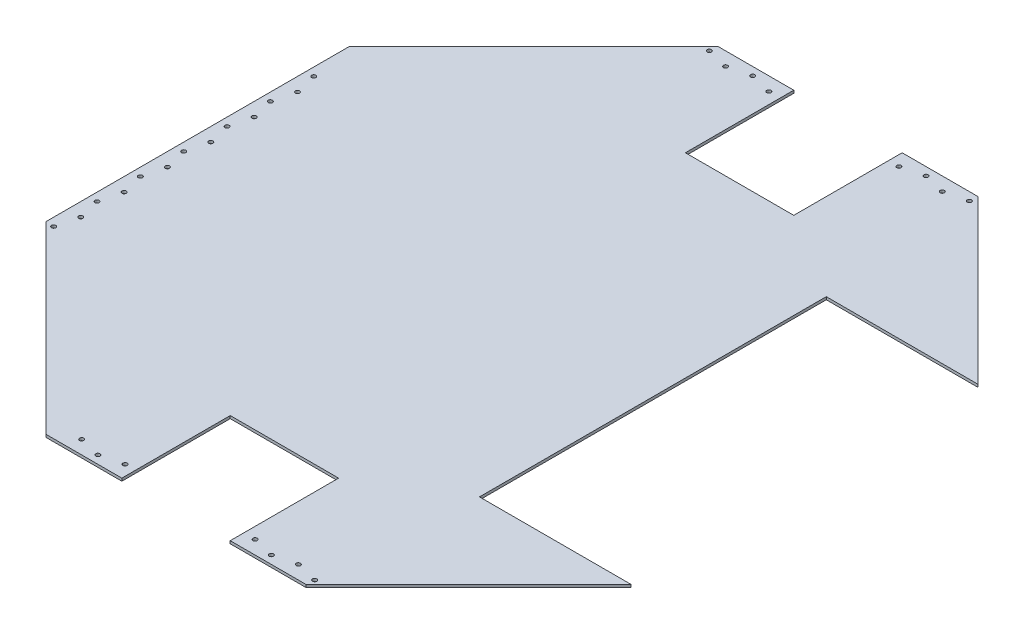
from build123d import *

# Parameters (mm, degrees)
BOSS_EXTRUDE1_DEPTH           = 3.175
SKETCH2_W                     = 203.2
SKETCH2_H                     = 406.4
INTAKE_CUTOUT_DEPTH           = 3.175
SKETCH3_W                     = 127
SKETCH3_H                     = 127
CLIMBER_CUTOUT_DEPTH          = 3.175
F_3_16_0_195_DIAMETER_HOLE1_D = 4.953


with BuildPart() as part:
    # Sketch1 → Boss-Extrude1 (new body)
    with BuildSketch(Plane(origin=(0, 0, 0), x_dir=(1, 0, 0), z_dir=(0, 1, 0))):
        Polygon((152.4, 393.7), (368.3, 177.8), (368.3, -177.8), (152.4, -393.7), (-152.4, -393.7), (-368.3, -177.8), (-368.3, 177.8), (-152.4, 393.7), align=None)
    extrude(amount=BOSS_EXTRUDE1_DEPTH)

    # Sketch2 → Intake Cutout (cut)
    with BuildSketch(Plane(origin=(0, 3.175, 0), x_dir=(1, 0, 0), z_dir=(0, 1, 0))):
        with Locations((266.7, 0)):
            Rectangle(SKETCH2_W, SKETCH2_H)
    extrude(amount=-INTAKE_CUTOUT_DEPTH, mode=Mode.SUBTRACT)

    # Sketch3 → Climber Cutout (cut)
    with BuildSketch(Plane(origin=(0, 3.175, 0), x_dir=(1, 0, 0), z_dir=(0, 1, 0))):
        with Locations((0, 330.2)):
            Rectangle(SKETCH3_W, SKETCH3_H)
        with Locations((0, -330.2)):
            Rectangle(SKETCH3_W, SKETCH3_H)
    extrude(amount=-CLIMBER_CUTOUT_DEPTH, mode=Mode.SUBTRACT)

    # 3/16 (0.195) Diameter Hole1 (through all)
    with Locations(Plane(origin=(0, 3.175, 0), x_dir=(1, 0, 0), z_dir=(0, 1, 0))):
        with Locations((-152.944743879, 384.175), (-127.544743879, 377.825), (-102.144743879, 384.175), (-76.744743879, 377.825), (-51.344743879, 384.175), (-25.944743879, 377.825), (-0.544743879, 384.175), (24.855256121, 377.825), (50.255256121, 384.175), (75.655256121, 377.825), (101.055256121, 384.175), (126.455256121, 377.825), (151.855256121, 384.175), (202.655256121, 384.175), (409.575, 178.344743879), (403.225, 152.944743879), (409.575, 127.544743879), (403.225, 102.144743879), (409.575, 76.744743879), (403.225, 51.344743879), (409.575, 25.944743879), (403.225, 0.544743879), (409.575, -24.855256121), (403.225, -50.255256121), (409.575, -75.655256121), (403.225, -101.055256121), (409.575, -126.455256121), (361.95, -170.905256121), (152.944743879, -384.175), (127.544743879, -377.825), (102.144743879, -384.175), (76.744743879, -377.825), (51.344743879, -384.175), (25.944743879, -377.825), (0.544743879, -384.175), (-24.855256121, -377.825), (-50.255256121, -384.175), (-75.655256121, -377.825), (-101.055256121, -384.175), (-358.775, -178.344743879), (-352.425, -152.944743879), (-358.775, -127.544743879), (-352.425, -102.144743879), (-358.775, -76.744743879), (-352.425, -51.344743879), (-358.775, -25.944743879), (-352.425, -0.544743879), (-358.775, 24.855256121), (-352.425, 50.255256121), (-358.775, 75.655256121), (-352.425, 101.055256121), (-358.775, 126.455256121), (177.255256121, 377.825), (-126.455256121, -377.825), (178.344743879, -377.825), (203.744743879, -384.175)):
            Hole(F_3_16_0_195_DIAMETER_HOLE1_D / 2)


solid = part.part
